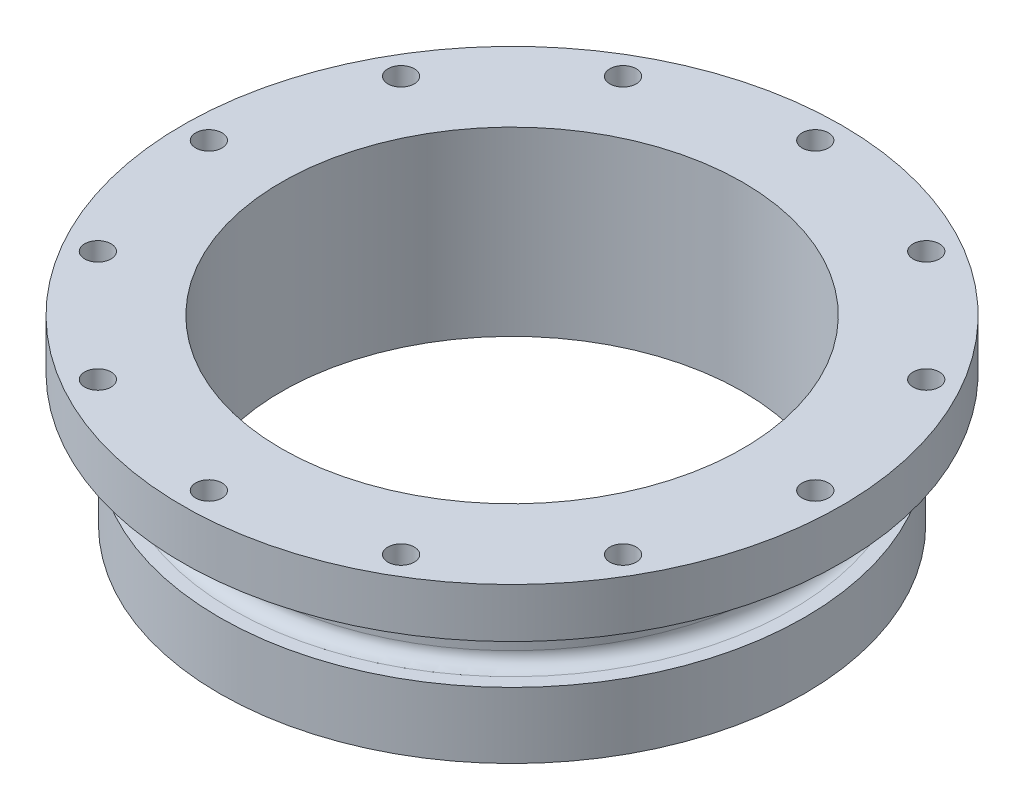
from build123d import *

# Parameters (mm, degrees)
SKETCH2_R           = 56.35625
BOSS_EXTRUDE1_DEPTH = 25.4
SKETCH3_R           = 63.5
BOSS_EXTRUDE2_DEPTH = 9.525
SKETCH4_R           = 44.45
CUT_EXTRUDE1_DEPTH  = 97.35484225
SKETCH9_W           = 5.08
SKETCH9_H           = 12.7
FILLET1_R           = 2.54
SKETCH10_R          = 2.54
CUT_EXTRUDE2_DEPTH  = 94.3255592
SKETCH11_R          = 2.032
CUT_EXTRUDE3_DEPTH  = 8.89


with BuildPart() as part:
    # Sketch2 → Boss-Extrude1 (new body)
    with BuildSketch(Plane(origin=(0, 0, 0), x_dir=(1, 0, 0), z_dir=(0, 1, 0))):
        Circle(SKETCH2_R)
    extrude(amount=BOSS_EXTRUDE1_DEPTH)

    # Sketch3 → Boss-Extrude2 (add)
    with BuildSketch(Plane(origin=(0, 25.4, 0), x_dir=(1, 0, 0), z_dir=(0, 1, 0))):
        Circle(SKETCH3_R)
    extrude(amount=BOSS_EXTRUDE2_DEPTH)

    # Sketch4 → Cut-Extrude1 (cut, through all)
    with BuildSketch(Plane.XZ):
        Circle(SKETCH4_R)
    extrude(amount=-CUT_EXTRUDE1_DEPTH, mode=Mode.SUBTRACT)

    # Sketch9 → Cut-Revolve1 (revolve, cut)
    with BuildSketch(Plane(origin=(0, 0, 0), x_dir=(0, 0, -1), z_dir=(1, 0, 0))):
        with Locations((53.81625, 19.05)):
            Rectangle(SKETCH9_W, SKETCH9_H)
    revolve(axis=Axis((0, 0, 0), (0, 1, 0)), mode=Mode.SUBTRACT)

    # Fillet1
    fillet1_edges = [part.edges().sort_by_distance(p)[0] for p in [
        (0, 12.7, 51.27625),
        (0, 25.4, 51.27625),
    ]]
    fillet(fillet1_edges, radius=FILLET1_R)

    # Sketch10 → Cut-Extrude2 (cut, through all)
    with BuildSketch(Plane.XZ.offset(-25.4)):
        with Locations((58.42, 0)):
            Circle(SKETCH10_R)
        with Locations((50.593204089, -29.21)):
            Circle(SKETCH10_R)
        with Locations((29.21, -50.593204089)):
            Circle(SKETCH10_R)
        with Locations((0, -58.42)):
            Circle(SKETCH10_R)
        with Locations((-29.21, -50.593204089)):
            Circle(SKETCH10_R)
        with Locations((-50.593204089, -29.21)):
            Circle(SKETCH10_R)
        with Locations((-58.42, 0)):
            Circle(SKETCH10_R)
        with Locations((-50.593204089, 29.21)):
            Circle(SKETCH10_R)
        with Locations((-29.21, 50.593204089)):
            Circle(SKETCH10_R)
        with Locations((0, 58.42)):
            Circle(SKETCH10_R)
        with Locations((29.21, 50.593204089)):
            Circle(SKETCH10_R)
        with Locations((50.593204089, 29.21)):
            Circle(SKETCH10_R)
    extrude(amount=-CUT_EXTRUDE2_DEPTH, mode=Mode.SUBTRACT)

    # Sketch11 → Cut-Extrude3 (cut)
    with BuildSketch(Plane.XZ):
        with Locations((51.6255, 0)):
            Circle(SKETCH11_R)
        with Locations((44.708994483, -25.81275)):
            Circle(SKETCH11_R)
        with Locations((25.81275, -44.708994483)):
            Circle(SKETCH11_R)
        with Locations((0, -51.6255)):
            Circle(SKETCH11_R)
        with Locations((-25.81275, -44.708994483)):
            Circle(SKETCH11_R)
        with Locations((-44.708994483, -25.81275)):
            Circle(SKETCH11_R)
        with Locations((-51.6255, 0)):
            Circle(SKETCH11_R)
        with Locations((-44.708994483, 25.81275)):
            Circle(SKETCH11_R)
        with Locations((-25.81275, 44.708994483)):
            Circle(SKETCH11_R)
        with Locations((0, 51.6255)):
            Circle(SKETCH11_R)
        with Locations((25.81275, 44.708994483)):
            Circle(SKETCH11_R)
        with Locations((44.708994483, 25.81275)):
            Circle(SKETCH11_R)
    extrude(amount=-CUT_EXTRUDE3_DEPTH, mode=Mode.SUBTRACT)


solid = part.part
